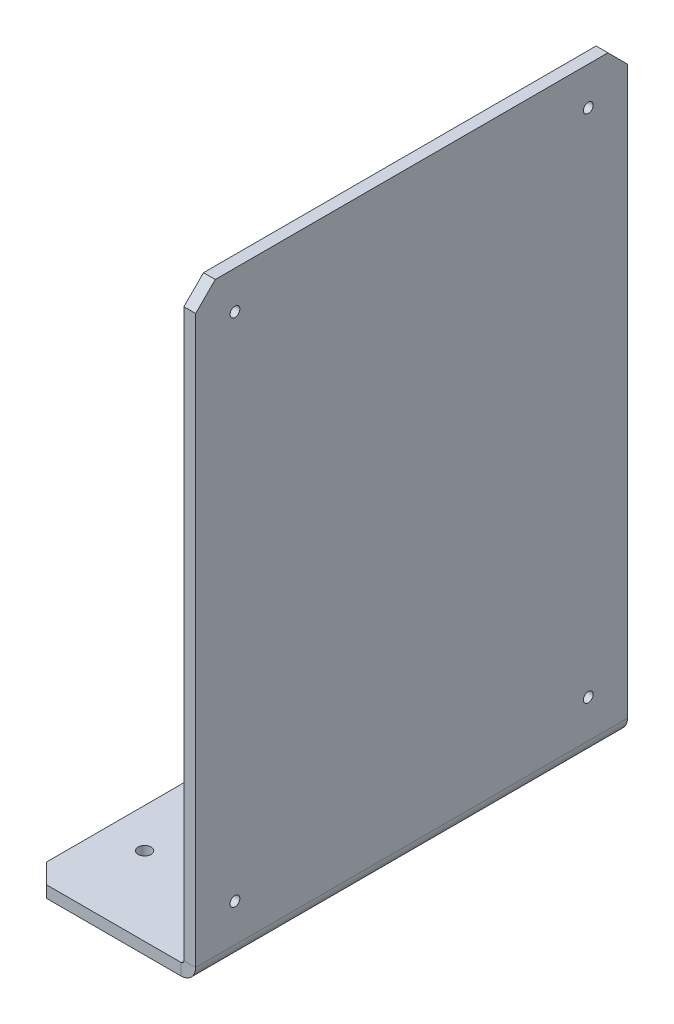
from build123d import *

# Parameters (mm, degrees)
SM_BASE_FLANGE_1_DEPTH = 110
M3X0_5_1_D             = 2.5
M3X0_5_1_DEPTH         = 8.5
M3X0_5_1_TIP           = 0.751075774
CHAMFER_1_SIZE         = 5
CUT_EXTRUDE_1_REACH    = 192.263
SKETCH_8_R             = 1.65


# Sheet-metal steps are written as plain solids
with BuildPart() as part:
    # Sketch 1 → 基材-凸緣1 (new body)
    with BuildSketch(Plane.XY):
        with BuildLine():
            Line((-40, 0), (-0.7366, 0))
            ThreePointArc((-0.7366, 0), (-0.215745145, 0.215745145), (0, 0.7366))
            Line((0, 0.7366), (0, 150))
            Line((0, 150), (3, 150))
            Line((3, 150), (3, 0.7366))
            ThreePointArc((3, 0.7366), (1.905575199, -1.905575199), (-0.7366, -3))
            Line((-0.7366, -3), (-40, -3))
            Line((-40, -3), (-40, 0))
        make_face()
    extrude(amount=SM_BASE_FLANGE_1_DEPTH)

    # M3x0.5 螺紋孔1
    with Locations(Plane.ZY):
        with Locations((10, 140.3683), (100, 140.3683), (100, 10.3683), (10, 10.3683)):
            Hole(M3X0_5_1_D / 2, depth=M3X0_5_1_DEPTH)
            with Locations((0, 0, -(M3X0_5_1_DEPTH + M3X0_5_1_TIP / 2))):  # 118° drill point
                Cone(0, M3X0_5_1_D / 2, M3X0_5_1_TIP, mode=Mode.SUBTRACT)

    # 導角1
    chamfer_1_edges = [part.edges().sort_by_distance(p)[0] for p in [
        (-40, -1.5, 110),
        (-40, -1.5, 0),
        (1.5, 150, 110),
        (1.5, 150, 0),
    ]]
    chamfer(chamfer_1_edges, length=CHAMFER_1_SIZE)

    # 草圖8 → 除料-伸長1 (cut, up to next)
    with BuildSketch(Plane(origin=(0, 0, 0), x_dir=(1, 0, 0), z_dir=(0, 1, 0)), mode=Mode.PRIVATE) as cut_extrude_1_sk1:
        with Locations(Location((-10, -20, 0), (0, 0, 270))):
            Circle(SKETCH_8_R)
    cut_extrude_1_tool1 = extrude(cut_extrude_1_sk1.sketch, amount=-CUT_EXTRUDE_1_REACH, mode=Mode.PRIVATE) & part.part
    # 草圖8 → 除料-伸長1 (cut, up to next)
    with BuildSketch(Plane(origin=(0, 0, 0), x_dir=(1, 0, 0), z_dir=(0, 1, 0)), mode=Mode.PRIVATE) as cut_extrude_1_sk2:
        with Locations(Location((-10, -90, 0), (0, 0, 270))):
            Circle(SKETCH_8_R)
    cut_extrude_1_tool2 = extrude(cut_extrude_1_sk2.sketch, amount=-CUT_EXTRUDE_1_REACH, mode=Mode.PRIVATE) & part.part
    # 草圖8 → 除料-伸長1 (cut, up to next)
    with BuildSketch(Plane(origin=(0, 0, 0), x_dir=(1, 0, 0), z_dir=(0, 1, 0)), mode=Mode.PRIVATE) as cut_extrude_1_sk3:
        with Locations(Location((-30, -90, 0), (0, 0, 270))):
            Circle(SKETCH_8_R)
    cut_extrude_1_tool3 = extrude(cut_extrude_1_sk3.sketch, amount=-CUT_EXTRUDE_1_REACH, mode=Mode.PRIVATE) & part.part
    # 草圖8 → 除料-伸長1 (cut, up to next)
    with BuildSketch(Plane(origin=(0, 0, 0), x_dir=(1, 0, 0), z_dir=(0, 1, 0)), mode=Mode.PRIVATE) as cut_extrude_1_sk4:
        with Locations(Location((-30, -20, 0), (0, 0, 270))):
            Circle(SKETCH_8_R)
    cut_extrude_1_tool4 = extrude(cut_extrude_1_sk4.sketch, amount=-CUT_EXTRUDE_1_REACH, mode=Mode.PRIVATE) & part.part
    add(cut_extrude_1_tool1.solids().sort_by_distance((-10, 0, 20))[0], mode=Mode.SUBTRACT)
    add(cut_extrude_1_tool2.solids().sort_by_distance((-10, 0, 90))[0], mode=Mode.SUBTRACT)
    add(cut_extrude_1_tool3.solids().sort_by_distance((-30, 0, 90))[0], mode=Mode.SUBTRACT)
    add(cut_extrude_1_tool4.solids().sort_by_distance((-30, 0, 20))[0], mode=Mode.SUBTRACT)


solid = part.part
